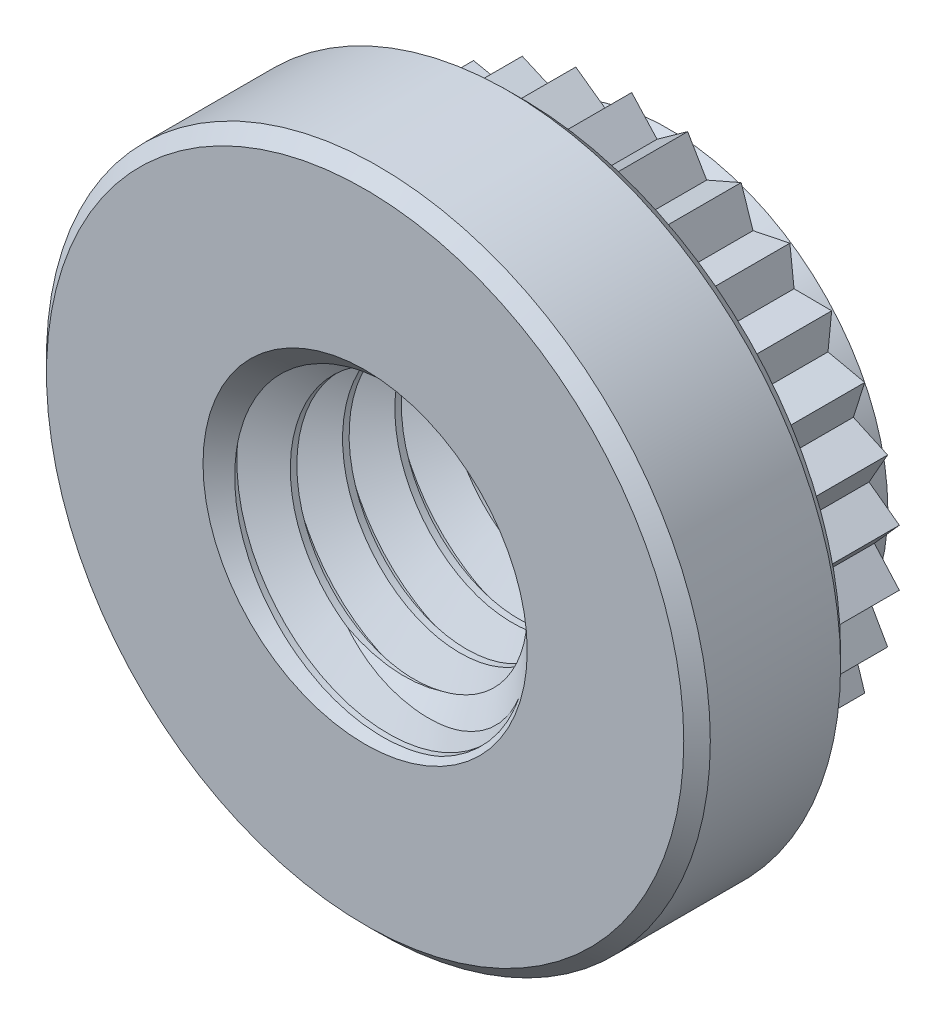
from build123d import *

# Parameters (mm, degrees)
SKETCH1_R           = 3.175
EXTRUDE1_DEPTH      = 1.5
SKETCH2_R           = 2.1125
EXTRUDE2_DEPTH      = 1.4
SKETCH5_OUTSIDE_W   = 10.492
SKETCH5_OUTSIDE_H   = 10.492
SKETCH5_OUTSIDE_R   = 2.1
CUT_EXTRUDE1_DEPTH  = 0.35
CUT_EXTRUDE1_DRAFT  = 20
CHAMFER2_SIZE       = 0.127
SKETCH7_R           = 1.5
CUT_EXTRUDE3_DEPTH  = 6.345208134
SWEEP1_PITCH        = 0.5
SKETCH10_R          = 3.175
CUT_EXTRUDE4_DEPTH  = 6.594757644
SKETCH11_R          = 2.1
CUT_EXTRUDE5_DEPTH  = 6.345208189
BOSS_EXTRUDE1_START = -1.05
BOSS_EXTRUDE1_DEPTH = 1.05
CIRPATTERN4_COUNT   = 30


with BuildPart() as part:
    # Sketch1 → Extrude1 (new body)
    with BuildSketch(Plane.XY):
        Circle(SKETCH1_R)
    extrude(amount=-EXTRUDE1_DEPTH)

    # Sketch2 → Extrude2 (add)
    with BuildSketch(Plane(origin=(0, 0, -1.5), x_dir=(-1, 0, 0), z_dir=(0, 0, -1))):
        with Locations(Location((0, 0, 0), (0, 0, 180))):
            Circle(SKETCH2_R)
    extrude(amount=EXTRUDE2_DEPTH)


with BuildPart() as cut_extrude1_tool:
    # Sketch5 outside → Cut-Extrude1 (with draft: the straight prism first)
    with BuildSketch(Plane(origin=(0, 0, -2.9), x_dir=(-1, 0, 0), z_dir=(0, 0, -1))):
        Rectangle(SKETCH5_OUTSIDE_W, SKETCH5_OUTSIDE_H)
        Circle(SKETCH5_OUTSIDE_R, mode=Mode.SUBTRACT)
    extrude(amount=-CUT_EXTRUDE1_DEPTH)
    # Cut-Extrude1: the draft: its side faces are tilted about the plane it starts from
    cut_extrude1_sides = [cut_extrude1_tool.faces().sort_by_distance(p)[0] for p in [
        (0, -5.246, -2.725),
        (-5.246, 0, -2.725),
        (0, 5.246, -2.725),
        (5.246, 0, -2.725),
        (2.1, 0, -2.725),
    ]]
    draft(cut_extrude1_sides, Plane(origin=(0, 0, -2.9), x_dir=(-1, 0, 0), z_dir=(0, 0, -1)), CUT_EXTRUDE1_DRAFT)


with BuildPart() as part_1:
    add(part.part)

    # Cut-Extrude1: cut by cut_extrude1_tool
    add(cut_extrude1_tool.part, mode=Mode.SUBTRACT)

    # Chamfer2
    chamfer2_edges = [part_1.edges().sort_by_distance(p)[0] for p in [
        (-3.175, 0, 0),
        (-3.175, 0, -1.5),
    ]]
    chamfer(chamfer2_edges, length=CHAMFER2_SIZE)

    # Sketch7 → Cut-Extrude3 (cut, through all)
    with BuildSketch(Plane.XY):
        Circle(SKETCH7_R)
    extrude(amount=-CUT_EXTRUDE3_DEPTH, mode=Mode.SUBTRACT)

    # Sweep1: the profile of Sketch9 profile screwed along a right-hand helix of 9.8 turns, 6 arcs to a turn; built about Z, then put on its axis
    sweep1_z = Axis((0, 0, 0), (0, 0, 1))
    sweep1_corners = [(1.5003, 0, -0.437673205), (1.175240474, 0, -0.25), (1.175240474, 0, -0.1875), (1.5003, 0, 0.000173205)]
    with BuildLine(mode=Mode.PRIVATE) as sweep1_profile:
        Line(sweep1_corners[0], sweep1_corners[1])
        Line(sweep1_corners[1], sweep1_corners[2])
        Line(sweep1_corners[2], sweep1_corners[3])
        Line(sweep1_corners[3], sweep1_corners[0])
    sweep1_cap = Face(sweep1_profile.wire())
    sweep1_turn_angles = [0, 30, 60, 90, 120, 150, 180, 210, 240, 270, 300, 330, 360]
    sweep1_turn_weights = [1, 0.8660254037844387, 1, 0.8660254037844387, 1, 0.8660254037844387, 1, 0.8660254037844387, 1, 0.8660254037844387, 1, 0.8660254037844387, 1]
    sweep1_turn_rails = [Edge.make_bspline([Vector(p[0], p[1], 0).rotate(sweep1_z, sweep1_turn_angles[k]) / sweep1_turn_weights[k] + Vector(0, 0, p[2] + SWEEP1_PITCH * sweep1_turn_angles[k] / 360) for k in range(13)], [0, 0, 0, 1, 1, 2, 2, 3, 3, 4, 4, 5, 5, 6, 6, 6], 2, sweep1_turn_weights) for p in sweep1_corners]
    sweep1_turn_sides = [Face.make_surface_from_curves(sweep1_turn_rails[p[0]], sweep1_turn_rails[p[1]]) for p in [(0, 1), (1, 2), (2, 3), (3, 0)]]
    sweep1_last_angles = [3240, 3270, 3300, 3330, 3360, 3390, 3420, 3450, 3480, 3504, 3528]
    sweep1_last_weights = [1, 0.8660254037844387, 1, 0.8660254037844387, 1, 0.8660254037844387, 1, 0.8660254037844387, 1, 0.9135454576425653, 1]
    sweep1_last_rails = [Edge.make_bspline([Vector(p[0], p[1], 0).rotate(sweep1_z, sweep1_last_angles[k]) / sweep1_last_weights[k] + Vector(0, 0, p[2] + SWEEP1_PITCH * sweep1_last_angles[k] / 360) for k in range(11)], [0, 0, 0, 1, 1, 2, 2, 3, 3, 4, 4, 5, 5, 5], 2, sweep1_last_weights) for p in sweep1_corners]
    sweep1_last_sides = [Face.make_surface_from_curves(sweep1_last_rails[p[0]], sweep1_last_rails[p[1]]) for p in [(0, 1), (1, 2), (2, 3), (3, 0)]]
    sweep1 = Plane(origin=(0, 0, -2.9), x_dir=(0, 1, 0), z_dir=(0, 0, 1)) * Solid(Shell([*[p.moved(Location((0, 0, SWEEP1_PITCH * i))) for i in range(9) for p in sweep1_turn_sides], *sweep1_last_sides, sweep1_cap, sweep1_cap.rotate(sweep1_z, 3528).moved(Location((0, 0, SWEEP1_PITCH * 3528 / 360)))]))
    add(sweep1)

    # Sketch10 → Cut-Extrude4 (cut, through all)
    with BuildSketch(Plane.XY):
        Circle(SKETCH10_R)
    extrude(amount=CUT_EXTRUDE4_DEPTH, mode=Mode.SUBTRACT)

    # Sketch11 → Cut-Extrude5 (cut, through all)
    with BuildSketch(Plane(origin=(0, 0, -2.9), x_dir=(-1, 0, 0), z_dir=(0, 0, -1))):
        Circle(SKETCH11_R)
    extrude(amount=CUT_EXTRUDE5_DEPTH, mode=Mode.SUBTRACT)

    # Cut-Extrude6 cone 1 section (through the dimple's axis) → Cut-Extrude6 (revolve, cut)
    with BuildSketch(Plane(origin=(0, 0, 0), x_dir=(0, -1, 0), z_dir=(1, 0, 0))):
        Polygon((0, 0), (1.5508, 0), (0, 1.5508), align=None)
    revolve(axis=Axis((0, 0, 0), (0, 0, -1)), mode=Mode.SUBTRACT)

    # Cut-Extrude7 cone 1 section (through the dimple's axis) → Cut-Extrude7 (revolve, cut)
    with BuildSketch(Plane(origin=(0, 0, -2.9), x_dir=(0, 1, 0), z_dir=(1, 0, 0))):
        Polygon((0, 0), (1.5635, 0), (0, 1.5635), align=None)
    revolve(axis=Axis((0, 0, -2.9), (0, 0, 1)), mode=Mode.SUBTRACT)

    # Sketch16 → Boss-Extrude1 (add)
    with BuildSketch(Plane(origin=(0, 0, -2.55), x_dir=(-1, 0, 0), z_dir=(0, 0, -1)).offset(BOSS_EXTRUDE1_START)):
        with BuildLine():
            Line((0, 2.574), (-0.469444444, 2.059679141))
            ThreePointArc((-0.469444444, 2.059679141), (0, 2.1125), (0.469444444, 2.059679141))
            Line((0.469444444, 2.059679141), (0, 2.574))
        make_face()
    boss_extrude1 = extrude(amount=BOSS_EXTRUDE1_DEPTH)

    # CirPattern4: Boss-Extrude1 ×30 about axis
    cirpattern4_axis = Axis((0, 0, 0), (0, 0, 1))
    for i in range(1, CIRPATTERN4_COUNT):
        add(boss_extrude1.rotate(cirpattern4_axis, i * 360 / CIRPATTERN4_COUNT))


solid = part_1.part
